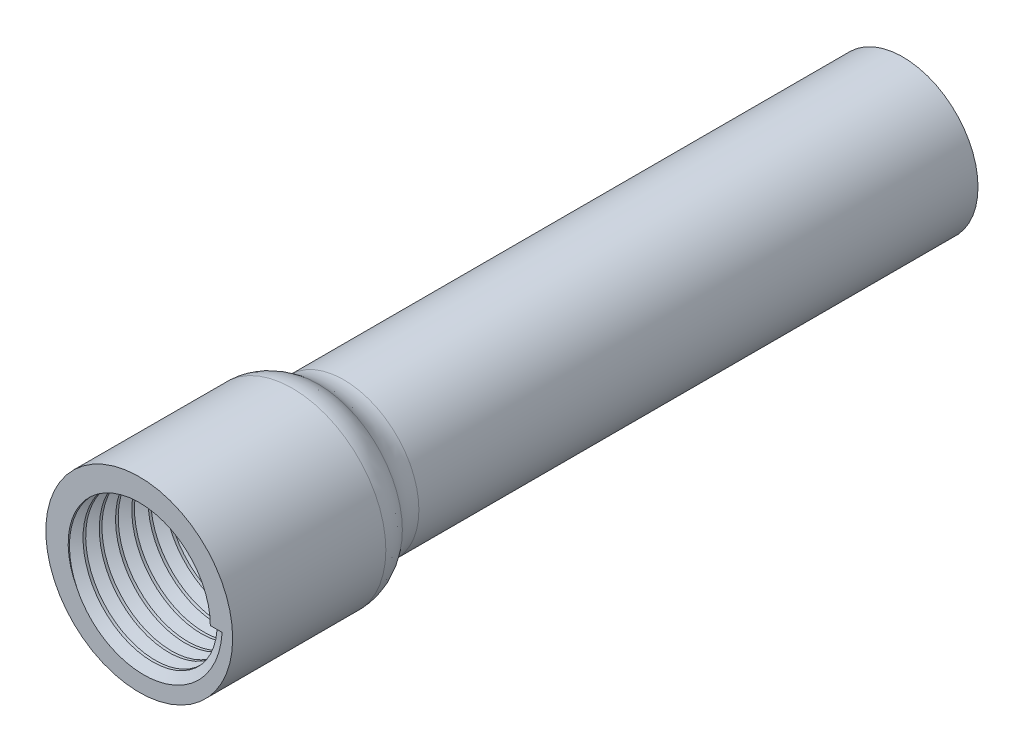
from build123d import *

# Parameters (mm, degrees)
SKETCH1_R                = 9.25
SKETCH1_R_2              = 6.5
BOSS_EXTRUDE1_DEPTH      = 74
BOSS_EXTRUDE2_DEPTH      = 20
BOSS_EXTRUDE2_DEPTH_BACK = 1
SKETCH6_R                = 11.5
SKETCH6_R_2              = 8.75
CUT_SWEEP4_PITCH         = 2
FILLET2_R                = 5
FILLET3_R                = 5


with BuildPart() as part:
    # Sketch1 → Boss-Extrude1 (new body)
    with BuildSketch(Plane.XY):
        Circle(SKETCH1_R)
        Circle(SKETCH1_R_2, mode=Mode.SUBTRACT)
    extrude(amount=BOSS_EXTRUDE1_DEPTH)

    # Sketch6 → Boss-Extrude2 (add, two sides: drawn at the far end of the back side and taken through both)
    with BuildSketch(Plane.XY.offset(74).offset(-BOSS_EXTRUDE2_DEPTH_BACK)):
        Circle(SKETCH6_R)
        Circle(SKETCH6_R_2, mode=Mode.SUBTRACT)
    extrude(amount=BOSS_EXTRUDE2_DEPTH + BOSS_EXTRUDE2_DEPTH_BACK)

    # Cut-Sweep4: the profile of Sketch5 screwed along a right-hand helix of 10 turns, 10 arcs to a turn; built about Z, then put on its axis
    cut_sweep4_z = Axis((0, 0, 0), (0, 0, 1))
    cut_sweep4_corners = [(7.77, 0, 1.402961154), (7.77, 0, -1.402961154), (10.2, 0, 0)]
    with BuildLine(mode=Mode.PRIVATE) as cut_sweep4_profile:
        Line(cut_sweep4_corners[0], cut_sweep4_corners[1])
        Line(cut_sweep4_corners[1], cut_sweep4_corners[2])
        Line(cut_sweep4_corners[2], cut_sweep4_corners[0])
    cut_sweep4_cap = Face(cut_sweep4_profile.wire())
    cut_sweep4_turn_angles = [0, 18, 36, 54, 72, 90, 108, 126, 144, 162, 180, 198, 216, 234, 252, 270, 288, 306, 324, 342, 360]
    cut_sweep4_turn_weights = [1, 0.9510565162951535, 1, 0.9510565162951535, 1, 0.9510565162951535, 1, 0.9510565162951535, 1, 0.9510565162951535, 1, 0.9510565162951535, 1, 0.9510565162951535, 1, 0.9510565162951535, 1, 0.9510565162951535, 1, 0.9510565162951535, 1]
    cut_sweep4_turn_rails = [Edge.make_bspline([Vector(p[0], p[1], 0).rotate(cut_sweep4_z, cut_sweep4_turn_angles[k]) / cut_sweep4_turn_weights[k] + Vector(0, 0, p[2] + CUT_SWEEP4_PITCH * cut_sweep4_turn_angles[k] / 360) for k in range(21)], [0, 0, 0, 1, 1, 2, 2, 3, 3, 4, 4, 5, 5, 6, 6, 7, 7, 8, 8, 9, 9, 10, 10, 10], 2, cut_sweep4_turn_weights) for p in cut_sweep4_corners]
    cut_sweep4_turn_sides = [Face.make_surface_from_curves(cut_sweep4_turn_rails[p[0]], cut_sweep4_turn_rails[p[1]]) for p in [(0, 1), (1, 2), (2, 0)]]
    cut_sweep4 = Plane(origin=(0, 0, 94), x_dir=(1, 0, 0), z_dir=(0, 0, -1)) * Solid(Shell([*[p.moved(Location((0, 0, CUT_SWEEP4_PITCH * i))) for i in range(10) for p in cut_sweep4_turn_sides], cut_sweep4_cap, cut_sweep4_cap.rotate(cut_sweep4_z, 3600).moved(Location((0, 0, CUT_SWEEP4_PITCH * 3600 / 360)))]))
    add(cut_sweep4, mode=Mode.SUBTRACT)

    # Fillet2
    # the kernel refuses this fillet: 5 mm, written as the material it adds along each edge
    with BuildSketch(Plane(origin=(0, 0, 73), x_dir=(1, 0, 0), z_dir=(0, 1, 0))) as fillet2_piece_1:
        with BuildLine():
            CenterArc((14.25, 4.175823272), FILLET2_R, 180, 56.632987031)
            Line((11.5, 0), (11.445, -0.083516465))
            ThreePointArc((11.445, -0.083516465), (10.375, -0.1), (9.25, -0.1))
            Line((9.25, -0.1), (9.15, 0))
            Line((9.15, 0), (9.15, 4.175823272))
            Line((9.15, 4.175823272), (9.25, 4.175823272))
        make_face()
    revolve(axis=Axis((0, 0, 73), (0, 0, -1)))

    # Fillet3
    fillet3_edges = [part.edges().sort_by_distance(p)[0] for p in [
        (-11.5, 0, 73),
    ]]
    fillet(fillet3_edges, radius=FILLET3_R)


solid = part.part
